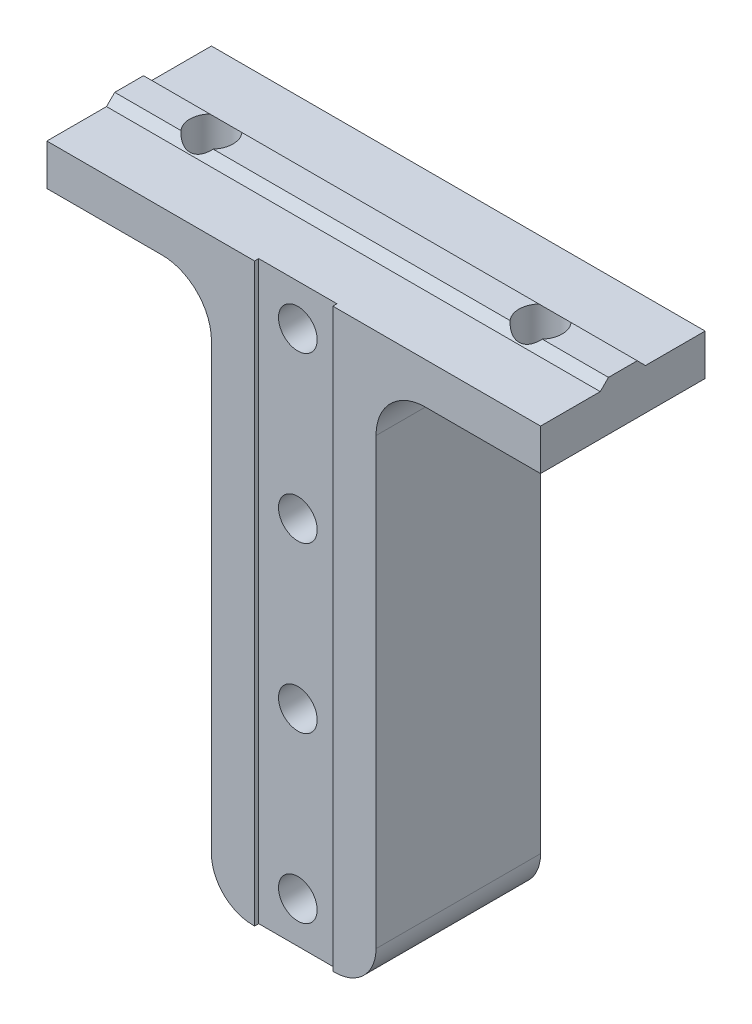
from build123d import *

# Parameters (mm, degrees)
SKETCH2_W           = 20
SKETCH2_H           = 70
BOSS_EXTRUDE1_DEPTH = 20
SKETCH3_W           = 9.5
SKETCH3_H           = 70
CUT_EXTRUDE1_DEPTH  = 0.5
SKETCH4_R           = 2.35
CUT_EXTRUDE2_DEPTH  = 5.5
SKETCH5_W           = 20
SKETCH5_H           = 20
BOSS_EXTRUDE2_DEPTH = 5
FILLET1_R           = 6
FILLET2_R           = 6
SKETCH6_W           = 60
SKETCH6_H           = 5.5
BOSS_EXTRUDE3_DEPTH = 1
CHAMFER1_SIZE       = 1
SKETCH7_R           = 2.625
CUT_EXTRUDE3_DEPTH  = 75.520767082
FILLET3_R           = 5
FILLET4_R           = 5


with BuildPart() as part:
    # Sketch2 → Boss-Extrude1 (new body)
    with BuildSketch(Plane.XY):
        with Locations((-0.46875, 8.59375)):
            Rectangle(SKETCH2_W, SKETCH2_H)
    extrude(amount=BOSS_EXTRUDE1_DEPTH)

    # Sketch3 → Cut-Extrude1 (cut)
    with BuildSketch(Plane.XY.offset(20)):
        with Locations((-0.46875, 8.59375)):
            Rectangle(SKETCH3_W, SKETCH3_H)
    extrude(amount=-CUT_EXTRUDE1_DEPTH, mode=Mode.SUBTRACT)

    # Sketch4 → Cut-Extrude2 (cut)
    with BuildSketch(Plane.XY.offset(19.5)):
        with Locations((-0.46875, 38.59375)):
            Circle(SKETCH4_R)
        with Locations((-0.46875, 18.59375)):
            Circle(SKETCH4_R)
        with Locations((-0.46875, -1.40625)):
            Circle(SKETCH4_R)
        with Locations((-0.46875, 78.59375)):
            Circle(SKETCH4_R)
        with Locations((-0.46875, -21.40625)):
            Circle(SKETCH4_R)
        with Locations((-0.46875, 58.59375)):
            Circle(SKETCH4_R)
    extrude(amount=-CUT_EXTRUDE2_DEPTH, mode=Mode.SUBTRACT)

    # Sketch5 → Boss-Extrude2 (add)
    with BuildSketch(Plane(origin=(0, 43.59375, 0), x_dir=(1, 0, 0), z_dir=(0, 1, 0))):
        with Locations((19.53125, -10)):
            Rectangle(SKETCH5_W, SKETCH5_H)
        with Locations((-20.46875, -10)):
            Rectangle(SKETCH5_W, SKETCH5_H)
    extrude(amount=-BOSS_EXTRUDE2_DEPTH)

    # Fillet1
    fillet1_edges = [part.edges().sort_by_distance(p)[0] for p in [
        (9.53125, 38.59375, 10),
    ]]
    fillet(fillet1_edges, radius=FILLET1_R)

    # Fillet2
    fillet2_edges = [part.edges().sort_by_distance(p)[0] for p in [
        (-10.46875, 38.59375, 10),
    ]]
    fillet(fillet2_edges, radius=FILLET2_R)

    # Sketch6 → Boss-Extrude3 (add)
    with BuildSketch(Plane(origin=(0, 43.59375, 0), x_dir=(1, 0, 0), z_dir=(0, 1, 0))):
        with Locations((-0.46875, -10)):
            Rectangle(SKETCH6_W, SKETCH6_H)
    extrude(amount=BOSS_EXTRUDE3_DEPTH)

    # Chamfer1
    chamfer1_edges = [part.edges().sort_by_distance(p)[0] for p in [
        (-0.46875, 44.59375, 7.25),
        (-0.46875, 44.59375, 12.75),
    ]]
    chamfer(chamfer1_edges, length=CHAMFER1_SIZE - 0.0001)  # a hair under: the kernel refuses the full size

    # Sketch7 → Cut-Extrude3 (cut, through all)
    with BuildSketch(Plane.XZ.offset(-38.59375)):
        with Locations(Location((19.53125, 10, 0), (0, 0, 270))):
            Circle(SKETCH7_R)
        with Locations(Location((-20.46875, 10, 0), (0, 0, 270))):
            Circle(SKETCH7_R)
    extrude(amount=-CUT_EXTRUDE3_DEPTH, mode=Mode.SUBTRACT)

    # Fillet3
    fillet3_edges = [part.edges().sort_by_distance(p)[0] for p in [
        (-10.46875, -26.40625, 10),
    ]]
    fillet(fillet3_edges, radius=FILLET3_R)

    # Fillet4
    fillet4_edges = [part.edges().sort_by_distance(p)[0] for p in [
        (9.53125, -26.40625, 10),
    ]]
    fillet(fillet4_edges, radius=FILLET4_R)


solid = part.part
